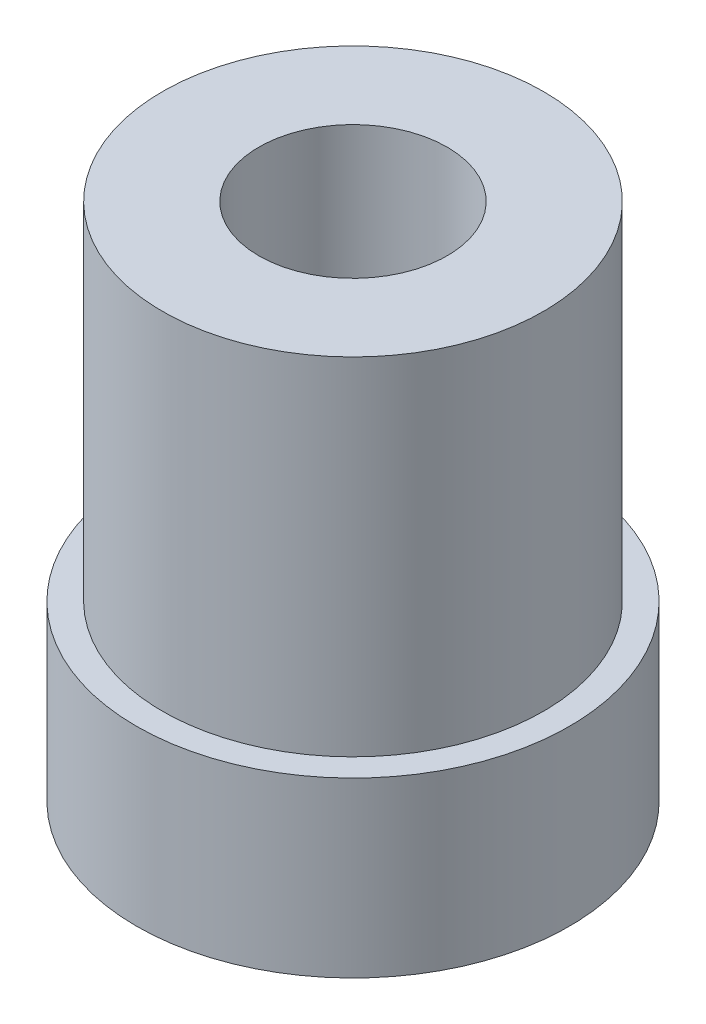
from build123d import *

# Parameters (mm, degrees)
SKETCH1_R           = 6.985
SKETCH1_R_2         = 3.4544
BOSS_EXTRUDE1_DEPTH = 19.05
SKETCH2_3_R         = 7.9375
SKETCH2_3_R_2       = 6.985
BOSS_EXTRUDE2_DEPTH = 6.35


with BuildPart() as part:
    # Sketch1 → Boss-Extrude1 (new body)
    with BuildSketch(Plane(origin=(0, 0, 0), x_dir=(1, 0, 0), z_dir=(0, 1, 0))):
        Circle(SKETCH1_R)
        Circle(SKETCH1_R_2, mode=Mode.SUBTRACT)
    extrude(amount=BOSS_EXTRUDE1_DEPTH)

    # Sketch2<3> → Boss-Extrude2 (add)
    with BuildSketch(Plane(origin=(0, 0, 0), x_dir=(1, 0, 0), z_dir=(0, 1, 0))):
        Circle(SKETCH2_3_R)
        Circle(SKETCH2_3_R_2, mode=Mode.SUBTRACT)
    extrude(amount=BOSS_EXTRUDE2_DEPTH)


solid = part.part
